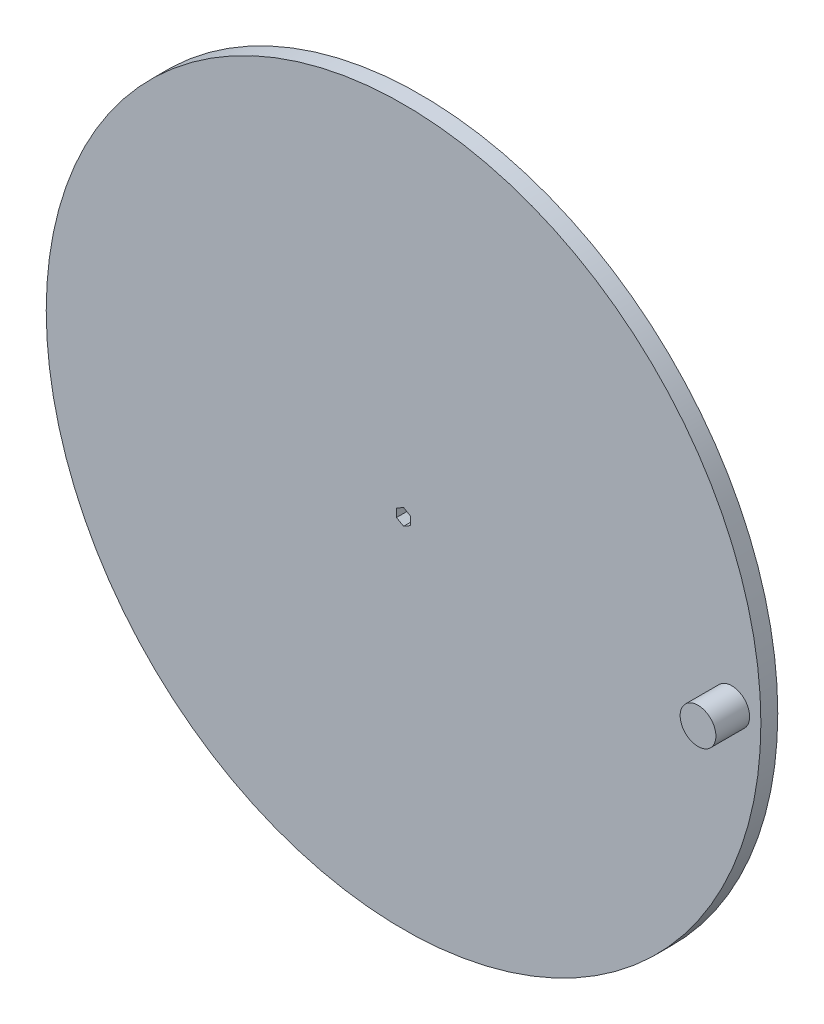
from build123d import *

# Parameters (mm, degrees)
SKETCH1_R           = 63.5
BOSS_EXTRUDE1_DEPTH = 3
SKETCH3_R           = 3.175
BOSS_EXTRUDE2_DEPTH = 6
CUT_EXTRUDE1_DEPTH  = 6
SKETCH5_R           = 2.5
BOSS_EXTRUDE3_DEPTH = 6.5
FILLET1_R           = 10


with BuildPart() as part:
    # Sketch1 → Boss-Extrude1 (new body)
    with BuildSketch(Plane.XY):
        Circle(SKETCH1_R)
    extrude(amount=BOSS_EXTRUDE1_DEPTH)

    # Sketch3 → Boss-Extrude2 (add)
    with BuildSketch(Plane.XY.offset(3)):
        with Locations((58.325, 0)):
            Circle(SKETCH3_R)
    extrude(amount=BOSS_EXTRUDE2_DEPTH)

    # Sketch4 → Cut-Extrude1 (cut)
    with BuildSketch(Plane.XY.offset(3)):
        Polygon((0, 1.443375673), (-1.25, 0.721687836), (-1.25, -0.721687836), (0, -1.443375673), (1.25, -0.721687836), (1.25, 0.721687836), align=None)
    extrude(amount=-CUT_EXTRUDE1_DEPTH, mode=Mode.SUBTRACT)

    # Sketch5 → Boss-Extrude3 (add)
    with BuildSketch(Plane(origin=(0, 0, 0), x_dir=(-1, 0, 0), z_dir=(0, 0, -1))):
        with Locations(Location((0, 0, 0), (0, 0, 180))):
            Circle(SKETCH5_R)
        Polygon((-1.25, 0.721687836), (0, 1.443375673), (1.25, 0.721687836), (1.25, -0.721687836), (0, -1.443375673), (-1.25, -0.721687836), align=None, mode=Mode.SUBTRACT)
    extrude(amount=BOSS_EXTRUDE3_DEPTH)

    # Fillet1
    # the kernel refuses this fillet: 10 mm, written as the material it adds along each edge
    with BuildSketch(Plane(origin=(0, 0, 0), x_dir=(1, 0, 0), z_dir=(0, 1, 0))) as fillet1_piece_1:
        with BuildLine():
            CenterArc((11.867496998, 10), FILLET1_R, 200.487315115, 69.512684885)
            Line((11.867496998, 0), (11.867496998, -0.2))
            Line((11.867496998, -0.2), (2.5, -0.2))
            Line((2.5, -0.2), (2.3, 0))
            ThreePointArc((2.3, 0), (2.3, 3.25), (2.31265006, 6.43))
            Line((2.31265006, 6.43), (2.5, 6.5))
        make_face()
    revolve(axis=Axis((0, 0, 0), (0, 0, -1)))


solid = part.part
